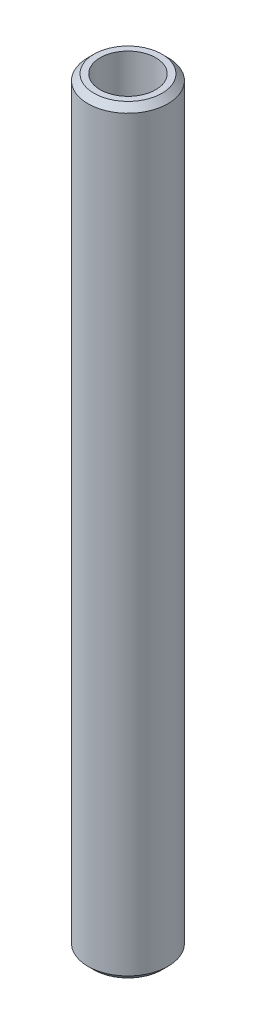
from build123d import *

# Parameters (mm, degrees)
SKETCH1_R           = 30
BOSS_EXTRUDE1_DEPTH = 569.861112314
SKETCH2_R           = 20.841764477
CUT_EXTRUDE1_DEPTH  = 572.438262044
CHAMFER1_SIZE       = 4.518782963


with BuildPart() as part:
    # Sketch1 → Boss-Extrude1 (new body)
    with BuildSketch(Plane(origin=(0, 0, 0), x_dir=(1, 0, 0), z_dir=(0, 1, 0))):
        Circle(SKETCH1_R)
    extrude(amount=BOSS_EXTRUDE1_DEPTH)

    # Sketch2 → Cut-Extrude1 (cut, through all)
    with BuildSketch(Plane(origin=(0, 0, 0), x_dir=(1, 0, 0), z_dir=(0, 1, 0))):
        Circle(SKETCH2_R)
    extrude(amount=CUT_EXTRUDE1_DEPTH, mode=Mode.SUBTRACT)

    # Chamfer1
    chamfer1_edges = [part.edges().sort_by_distance(p)[0] for p in [
        (-30, 569.861112314, 0),
        (-30, 0, 0),
    ]]
    chamfer(chamfer1_edges, length=CHAMFER1_SIZE)


solid = part.part
